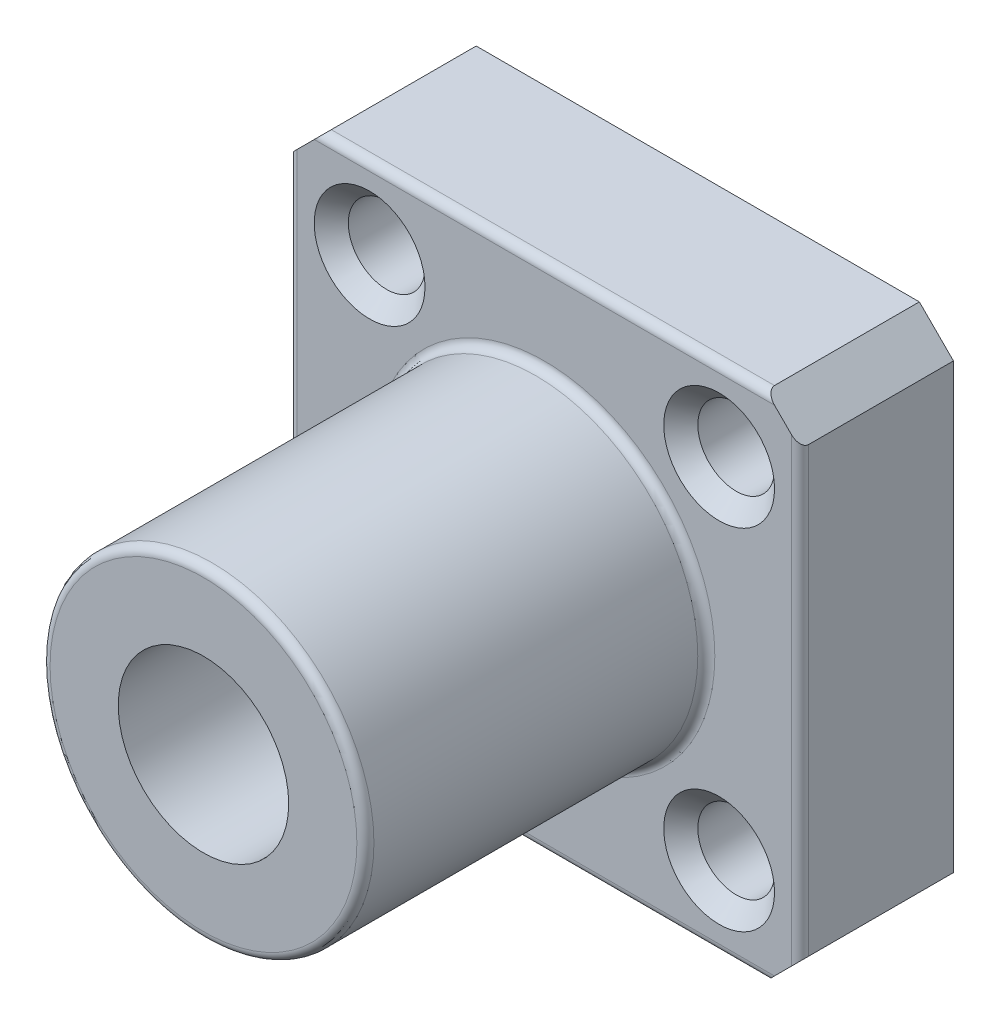
from build123d import *

# Parameters (mm, degrees)
SKETCH1_W                    = 30
SKETCH1_H                    = 30
BOSS_EXTRUDE1_DEPTH          = 9
SKETCH2_R                    = 9.5
BOSS_EXTRUDE2_DEPTH          = 20
SKETCH3_R                    = 5
CUT_EXTRUDE1_DEPTH           = 36.930488446
SKETCH4_R                    = 2.25
CUT_EXTRUDE2_DEPTH           = 36.930488446
CHAMFER1_SIZE                = 1
CIRPATTERN1_COUNT            = 4
CHAMFER1_OF_CIRPATTERN1_SIZE = 1
FILLET1_R                    = 0.5
CHAMFER2_SIZE                = 2


with BuildPart() as part:
    # Sketch1 → Boss-Extrude1 (new body)
    with BuildSketch(Plane.XY):
        Rectangle(SKETCH1_W, SKETCH1_H)
    extrude(amount=BOSS_EXTRUDE1_DEPTH)

    # Sketch2 → Boss-Extrude2 (add)
    with BuildSketch(Plane.XY.offset(9)):
        Circle(SKETCH2_R)
    extrude(amount=BOSS_EXTRUDE2_DEPTH)

    # Sketch3 → Cut-Extrude1 (cut, through all)
    with BuildSketch(Plane.XY.offset(29)):
        Circle(SKETCH3_R)
    extrude(amount=-CUT_EXTRUDE1_DEPTH, mode=Mode.SUBTRACT)

    # Sketch4 → Cut-Extrude2 (cut, through all)
    with BuildSketch(Plane(origin=(0, 0, 0), x_dir=(-1, 0, 0), z_dir=(0, 0, -1))):
        with Locations((-10.253048327, 10.253048327)):
            Circle(SKETCH4_R)
    cut_extrude2 = extrude(amount=-CUT_EXTRUDE2_DEPTH, mode=Mode.SUBTRACT)

    # Chamfer1
    chamfer1_edges = [part.edges().sort_by_distance(p)[0] for p in [
        (12.503048327, 10.253048327, 9),
    ]]
    chamfer(chamfer1_edges, length=CHAMFER1_SIZE)

    # CirPattern1: Cut-Extrude2 ×4 about axis
    cirpattern1_axis = Axis((0, 0, 0), (0, 0, 1))
    for i in range(1, CIRPATTERN1_COUNT):
        add(cut_extrude2.rotate(cirpattern1_axis, i * 360 / CIRPATTERN1_COUNT), mode=Mode.SUBTRACT)

    # Chamfer1 of CirPattern1
    chamfer1_of_cirpattern1_edges = [part.edges().sort_by_distance(p)[0] for p in [
        (-10.253048327, 12.503048327, 9),
        (-12.503048327, -10.253048327, 9),
        (10.253048327, -12.503048327, 9),
    ]]
    chamfer(chamfer1_of_cirpattern1_edges, length=CHAMFER1_OF_CIRPATTERN1_SIZE)

    # Fillet1
    fillet1_edges = [part.edges().sort_by_distance(p)[0] for p in [
        (-15, 0, 9),
        (0, -15, 9),
        (-9.5, 0, 9),
        (-9.5, 0, 29),
        (15, 0, 9),
        (0, 15, 9),
    ]]
    fillet(fillet1_edges, radius=FILLET1_R)

    # Chamfer2
    # the kernel refuses this chamfer: 2 mm, written as the material it takes off along each edge
    with BuildSketch(Plane(origin=(15, -15, -5.143365976), x_dir=(-0.9996219169112968, -0.027495876610586487, 0), z_dir=(0, 0, 1)), Plane(origin=(-15, -15, -5.143365976), x_dir=(-0.027495876610586487, 0.9996219169112968, 0), z_dir=(0, 0, 1))) as chamfer2_piece_1:
        Polygon((CHAMFER2_SIZE * 0.999621916911, -CHAMFER2_SIZE * 0.0274958766106), (-CHAMFER2_SIZE * 0.0274958766106, -CHAMFER2_SIZE * 0.999621916911), (0, 0), align=None)
    extrude(amount=18.786731952, mode=Mode.SUBTRACT)
    with BuildSketch(Plane(origin=(15, 15, -5.143365976), x_dir=(-0.9996219169112968, 0.027495876610586487, 0), z_dir=(0, 0, 1)), Plane(origin=(-15, 15, -5.143365976), x_dir=(-0.027495876610586487, -0.9996219169112968, 0), z_dir=(0, 0, 1))) as chamfer2_piece_2:
        Polygon((CHAMFER2_SIZE * 0.999621916911, CHAMFER2_SIZE * 0.0274958766106), (-CHAMFER2_SIZE * 0.0274958766106, CHAMFER2_SIZE * 0.999621916911), (0, 0), align=None)
    extrude(amount=18.786731952, mode=Mode.SUBTRACT)


solid = part.part
